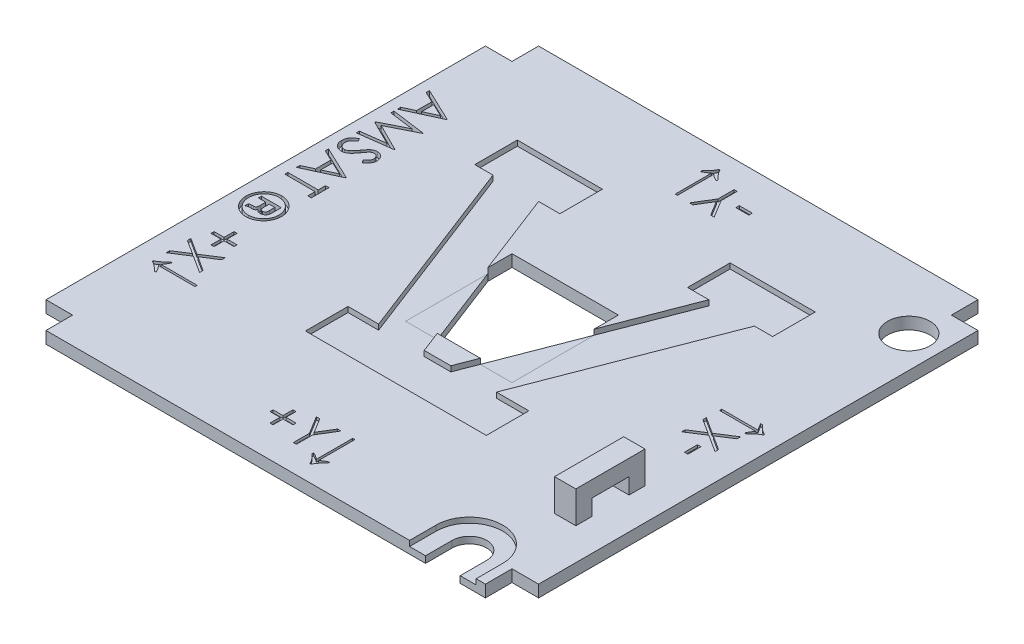
from build123d import *

# Parameters (mm, degrees)
BOSS_EXTRUDE1_DEPTH   = 2.25
CUT_EXTRUDE3_DEPTH    = 10
CUT_EXTRUDE4_DEPTH    = 1
SKETCH7_W             = 20
SKETCH7_H             = 20
CUT_EXTRUDE5_DEPTH    = 10
CUT_EXTRUDE9_DEPTH    = 1
CUT_EXTRUDE10_DEPTH   = 1
CUT_EXTRUDE7_DEPTH    = 1
BOSS_EXTRUDE3_DEPTH   = 2.25
BOSS_EXTRUDE3_2_DEPTH = 2.25
CUT_EXTRUDE8_DEPTH    = 1
SKETCH22_W            = 2.442307692
SKETCH22_H            = 0.651282051
SKETCH22_W_2          = 0.651282051
SKETCH22_H_2          = 2.442307693
CUT_EXTRUDE11_DEPTH   = 0.5
SKETCH23_W            = 4
SKETCH23_H            = 3
BOSS_EXTRUDE4_DEPTH   = 3
SKETCH24_W            = 4
SKETCH24_H            = 13
BOSS_EXTRUDE5_DEPTH   = 3
SKETCH3_R             = 4
CUT_EXTRUDE1_DEPTH    = 10


with BuildPart() as part:
    # Sketch2 → Boss-Extrude1 (new body)
    with BuildSketch(Plane(origin=(0, 0, 0), x_dir=(1, 0, 0), z_dir=(0, 1, 0))):
        Polygon((-41.3, 41.3), (-46.3, 41.3), (-46.3, -41.3), (-41.3, -41.3), (-41.3, -46.3), (41.3, -46.3), (41.3, -41.3), (46.3, -41.3), (46.3, 41.3), (41.3, 41.3), (41.3, 46.3), (-41.3, 46.3), align=None)
    extrude(amount=BOSS_EXTRUDE1_DEPTH)

    # Sketch5 → Cut-Extrude3 (cut)
    with BuildSketch(Plane(origin=(0, 2.25, 0), x_dir=(1, 0, 0), z_dir=(0, 1, 0))):
        with BuildLine():
            Line((30.05, -41.3), (30.05, -46.3))
            Line((30.05, -46.3), (36.55, -46.3))
            Line((36.55, -46.3), (36.55, -41.3))
            ThreePointArc((36.55, -41.3), (33.3, -38.05), (30.05, -41.3))
        make_face()
    extrude(amount=-CUT_EXTRUDE3_DEPTH, mode=Mode.SUBTRACT)

    # Sketch6 → Cut-Extrude4 (cut)
    with BuildSketch(Plane(origin=(0, 2.25, 0), x_dir=(1, 0, 0), z_dir=(0, 1, 0))):
        with BuildLine():
            Line((27.05, -46.3), (27.05, -41.3))
            ThreePointArc((27.05, -41.3), (33.3, -35.05), (39.55, -41.3))
            Line((39.55, -41.3), (39.55, -46.3))
            Line((39.55, -46.3), (36.55, -46.3))
            Line((36.55, -46.3), (36.55, -41.3))
            Line((36.55, -41.3), (30.05, -41.3))
            Line((30.05, -41.3), (30.05, -46.3))
            Line((30.05, -46.3), (27.05, -46.3))
        make_face()
    extrude(amount=-CUT_EXTRUDE4_DEPTH, mode=Mode.SUBTRACT)

    # Sketch7 → Cut-Extrude5 (cut)
    with BuildSketch(Plane(origin=(0, 2.25, 0), x_dir=(1, 0, 0), z_dir=(0, 1, 0))):
        Rectangle(SKETCH7_W, SKETCH7_H)
    extrude(amount=-CUT_EXTRUDE5_DEPTH, mode=Mode.SUBTRACT)

    # Sketch12 → Cut-Extrude9 (cut)
    # profile 1 of 5: a face of its own
    with BuildSketch(Plane(origin=(0, 2.25, 0), x_dir=(1, 0, 0), z_dir=(0, 1, 0))):
        Polygon((-37.95, 25.69277339), (-44.3, 22.762004159), (-44.3, 23.381485329), (-42.26474359, 24.320247348), (-42.26474359, 27.198863133), (-44.3, 28.164337893), (-44.3, 28.786363133), (-37.95, 25.774183646), align=None)
        Polygon((-39.187690304, 25.739838694), (-41.613461538, 26.889758566), (-41.613461538, 24.620447669), align=None, mode=Mode.SUBTRACT)
    # profile 2 of 5: a face of its own
    with BuildSketch(Plane(origin=(0, 2.25, 0), x_dir=(1, 0, 0), z_dir=(0, 1, 0))):
        Polygon((-44.3, 22.110722108), (-37.95, 21.272450874), (-37.95, 21.191040617), (-43.16025641, 18.569375954), (-37.95, 15.954071467), (-37.95, 15.871389175), (-44.3, 15.0280298), (-44.3, 15.600445666), (-39.730849359, 16.208478518), (-44.3, 18.50068605), (-44.3, 18.629161611), (-39.720673077, 20.93027339), (-44.3, 21.537034207), align=None)
    # profile 3 of 5: a face of its own
    with BuildSketch(Plane(origin=(0, 2.25, 0), x_dir=(1, 0, 0), z_dir=(0, 1, 0))):
        with BuildLine():
            Line((-43.075030048, 14.376747749), (-42.753205128, 13.839948871))
            add(Edge.make_bspline(
                [(-42.753205128, 13.839948871), (-42.836779084, 13.790022926), (-42.996903557, 13.694366742), (-43.213271716, 13.534797848), (-43.397171629, 13.369456709), (-43.547533475, 13.197118918), (-43.665913598, 13.018836412), (-43.749737647, 12.833445344), (-43.802018059, 12.641570458), (-43.808368216, 12.510989382), (-43.811538462, 12.44579823)],
                knots=[0, 0, 0, 0, 1.272034388, 2.437168799, 3.508375237, 4.49857839, 5.41946034, 6.295179144, 7.148887113, 8, 8, 8, 8], degree=3))
            add(Edge.make_bspline(
                [(-43.811538462, 12.44579823), (-43.809987843, 12.390123491), (-43.806913739, 12.279748192), (-43.777375684, 12.117256778), (-43.731996643, 11.959446619), (-43.667006837, 11.809572137), (-43.588379893, 11.66969437), (-43.493403869, 11.547051602), (-43.387093572, 11.440960092), (-43.268404913, 11.354415497), (-43.141200057, 11.287230367), (-43.009462302, 11.238613348), (-42.873771122, 11.20767154), (-42.781776598, 11.203733268), (-42.735396635, 11.201747749)],
                knots=[0, 0, 0, 0, 1.095270387, 2.171376115, 3.241375676, 4.322296363, 5.380636668, 6.392615365, 7.366724986, 8.328592944, 9.273498763, 10.190095884, 11.087518669, 12, 12, 12, 12], degree=3))
            add(Edge.make_bspline(
                [(-42.735396635, 11.201747749), (-42.682526807, 11.20442257), (-42.575050174, 11.20986009), (-42.416482232, 11.255818632), (-42.259559998, 11.328116551), (-42.162493416, 11.394814491), (-42.112099359, 11.42944206)],
                knots=[0, 0, 0, 0, 0.938893495, 1.908633276, 2.914225137, 4, 4, 4, 4], degree=3))
            add(Edge.make_bspline(
                [(-42.112099359, 11.42944206), (-42.075654343, 11.457792544), (-41.998918, 11.517485547), (-41.88660379, 11.621528823), (-41.767920761, 11.740440233), (-41.643350859, 11.874814245), (-41.51516904, 12.027321936), (-41.380703341, 12.194831747), (-41.240357882, 12.378210806), (-41.1475488, 12.50744808), (-41.099559295, 12.574273791)],
                knots=[0, 0, 0, 0, 0.72226686, 1.520759855, 2.393439377, 3.351307446, 4.386958158, 5.510256019, 6.712608938, 8, 8, 8, 8], degree=3))
            add(Edge.make_bspline(
                [(-41.099559295, 12.574273791), (-41.051962251, 12.641074129), (-40.960960328, 12.76879129), (-40.826074223, 12.947538499), (-40.701964103, 13.107163547), (-40.590358776, 13.248479803), (-40.486390583, 13.367831235), (-40.395631639, 13.469580999), (-40.313235518, 13.549975161), (-40.25982663, 13.594712616), (-40.235847356, 13.61479863)],
                knots=[0, 0, 0, 0, 1.452255772, 2.776602448, 3.96446981, 5.032613149, 5.964194703, 6.766668629, 7.446264616, 8, 8, 8, 8], degree=3))
            add(Edge.make_bspline(
                [(-40.235847356, 13.61479863), (-40.198471189, 13.642870248), (-40.124965941, 13.698076852), (-40.010076556, 13.770949462), (-39.892468631, 13.832887657), (-39.771826134, 13.881442174), (-39.649842763, 13.922329314), (-39.524926932, 13.949830131), (-39.397639153, 13.967050237), (-39.311980373, 13.968813698), (-39.269100561, 13.969696467)],
                knots=[0, 0, 0, 0, 1.068054152, 2.10047183, 3.106115577, 4.101338837, 5.06977816, 6.043150881, 7.020423561, 8, 8, 8, 8], degree=3))
            add(Edge.make_bspline(
                [(-39.269100561, 13.969696467), (-39.201912345, 13.967338774), (-39.068972014, 13.962673783), (-38.874869119, 13.922898978), (-38.688987153, 13.860852909), (-38.515420527, 13.771116127), (-38.35457513, 13.660168238), (-38.208908417, 13.529045262), (-38.085408301, 13.373365589), (-37.978755215, 13.201602473), (-37.894548144, 13.014807794), (-37.830689649, 12.819420139), (-37.794988839, 12.614582726), (-37.789808182, 12.4756091), (-37.787179487, 12.405093101)],
                knots=[0, 0, 0, 0, 1.005541892, 1.989591032, 2.955705311, 3.932863626, 4.905387107, 5.876519979, 6.856563935, 7.871847665, 8.897921447, 9.918317993, 10.943742853, 12, 12, 12, 12], degree=3))
            add(Edge.make_bspline(
                [(-37.787179487, 12.405093101), (-37.789712055, 12.330253365), (-37.79473444, 12.181837219), (-37.839966426, 11.963114106), (-37.913030405, 11.752123978), (-37.997182386, 11.582287263), (-38.080853419, 11.44959562), (-38.157094819, 11.348409701), (-38.244859474, 11.245870377), (-38.344390297, 11.141153488), (-38.456597833, 11.036032532), (-38.58071441, 10.928947139), (-38.715981292, 10.819646819), (-38.812545746, 10.749332616), (-38.862049279, 10.71328621)],
                knots=[0, 0, 0, 0, 1.286821612, 2.551921131, 3.825787379, 5.12137259, 5.803616487, 6.523126609, 7.299589446, 8.125436757, 9.008162487, 9.944516264, 10.946261234, 12, 12, 12, 12], degree=3))
            Line((-38.862049279, 10.71328621), (-39.252564103, 11.228460489))
            add(Edge.make_bspline(
                [(-39.252564103, 11.228460489), (-39.212488906, 11.259568109), (-39.135313447, 11.319474112), (-39.027234075, 11.410423329), (-38.928506984, 11.49614586), (-38.842754703, 11.580601638), (-38.76528029, 11.659329911), (-38.698952227, 11.735742826), (-38.643110719, 11.808737593), (-38.583547263, 11.900760248), (-38.524128308, 12.01666691), (-38.474919269, 12.162019776), (-38.444283214, 12.313503716), (-38.440423429, 12.416395831), (-38.438461538, 12.468694864)],
                knots=[0, 0, 0, 0, 1.181667846, 2.275615987, 3.290305621, 4.226321945, 5.078535498, 5.862783384, 6.581873284, 7.217493746, 8.414623899, 9.604724551, 10.782505457, 12, 12, 12, 12], degree=3))
            add(Edge.make_bspline(
                [(-38.438461538, 12.468694864), (-38.440659908, 12.534293126), (-38.444899258, 12.660793195), (-38.491199802, 12.840389766), (-38.564101178, 13.002031602), (-38.666272638, 13.140919827), (-38.787323582, 13.256556914), (-38.926622362, 13.340205389), (-39.080441863, 13.390552116), (-39.187741726, 13.396695795), (-39.242387821, 13.399824672)],
                knots=[0, 0, 0, 0, 1.14458467, 2.207223713, 3.21896685, 4.227309161, 5.202851033, 6.127160689, 7.046193047, 8, 8, 8, 8], degree=3))
            add(Edge.make_bspline(
                [(-39.242387821, 13.399824672), (-39.276399686, 13.399078224), (-39.344479035, 13.397584107), (-39.445325449, 13.378151522), (-39.545276684, 13.350596701), (-39.644777183, 13.310268524), (-39.746167771, 13.25594828), (-39.849174706, 13.182089077), (-39.956398665, 13.089688175), (-40.026067509, 13.018768516), (-40.062850561, 12.981325073)],
                knots=[0, 0, 0, 0, 0.858526328, 1.718456515, 2.587092892, 3.476767204, 4.426280253, 5.487868114, 6.673670035, 8, 8, 8, 8], degree=3))
            add(Edge.make_bspline(
                [(-40.062850561, 12.981325073), (-40.075254879, 12.967425154), (-40.1047247, 12.934402129), (-40.152970695, 12.874030093), (-40.212484296, 12.794305302), (-40.286121284, 12.697309594), (-40.371540509, 12.581254523), (-40.467649776, 12.446127328), (-40.577569109, 12.293434262), (-40.65441779, 12.185081643), (-40.695052083, 12.127789416)],
                knots=[0, 0, 0, 0, 0.420754252, 0.999615792, 1.744751191, 2.668019286, 3.750313428, 4.999500688, 6.413464383, 8, 8, 8, 8], degree=3))
            add(Edge.make_bspline(
                [(-40.695052083, 12.127789416), (-40.745201407, 12.058872116), (-40.842308622, 11.925423316), (-40.988205641, 11.735544564), (-41.130895164, 11.563380084), (-41.269465966, 11.408325414), (-41.402866935, 11.268848738), (-41.53270299, 11.146497444), (-41.658043958, 11.040024853), (-41.818739917, 10.925399699), (-42.016099884, 10.80827337), (-42.257904688, 10.707686635), (-42.500649441, 10.644262204), (-42.663802416, 10.635968169), (-42.744300881, 10.631875954)],
                knots=[0, 0, 0, 0, 1.163667725, 2.253281268, 3.268753668, 4.215851969, 5.092017293, 5.902905408, 6.650798638, 7.335211899, 8.59617414, 9.77448103, 10.901945474, 12, 12, 12, 12], degree=3))
            add(Edge.make_bspline(
                [(-42.744300881, 10.631875954), (-42.801229752, 10.633068853), (-42.913981973, 10.635431485), (-43.079551282, 10.662565226), (-43.240328731, 10.70236958), (-43.394472649, 10.762174417), (-43.544045611, 10.835740017), (-43.687669837, 10.926604091), (-43.823370944, 11.036140674), (-43.953972858, 11.157886149), (-44.071943933, 11.293185837), (-44.177455847, 11.43584641), (-44.265768656, 11.586794036), (-44.336860696, 11.745298111), (-44.393343689, 11.910481824), (-44.433942484, 12.082519011), (-44.458916787, 12.261888745), (-44.461504744, 12.383810693), (-44.462820513, 12.44579823)],
                knots=[0, 0, 0, 0, 0.983610584, 1.948120116, 2.894308362, 3.843560551, 4.801159957, 5.773581695, 6.77566113, 7.813174769, 8.857584665, 9.875476876, 10.877851407, 11.875574773, 12.875048225, 13.892438445, 14.928473903, 16, 16, 16, 16], degree=3))
            add(Edge.make_bspline(
                [(-44.462820513, 12.44579823), (-44.461882457, 12.493757378), (-44.460018158, 12.589071679), (-44.443927019, 12.729674644), (-44.420329169, 12.867695712), (-44.384350994, 13.001401863), (-44.339671815, 13.13245798), (-44.284968625, 13.259695869), (-44.219847258, 13.383424662), (-44.144199851, 13.503788839), (-44.05701888, 13.621922576), (-43.956268568, 13.737220237), (-43.842644818, 13.851000836), (-43.71498239, 13.9611786), (-43.574645227, 14.069784393), (-43.420457442, 14.174798493), (-43.253219433, 14.278359297), (-43.135535911, 14.343339035), (-43.075030048, 14.376747749)],
                knots=[0, 0, 0, 0, 0.915384692, 1.819241058, 2.699029451, 3.586605375, 4.459625921, 5.340865773, 6.228072412, 7.126546901, 8.052715223, 9.028303326, 10.047266019, 11.120332924, 12.245748783, 13.433636234, 14.680528497, 16, 16, 16, 16], degree=3))
        make_face()
    # profile 4 of 5: a face of its own
    with BuildSketch(Plane(origin=(0, 2.25, 0), x_dir=(1, 0, 0), z_dir=(0, 1, 0))):
        Polygon((-37.95, 6.724183646), (-44.3, 3.793414416), (-44.3, 4.412895585), (-42.26474359, 5.351657605), (-42.26474359, 8.23027339), (-44.3, 9.195748149), (-44.3, 9.81777339), (-37.95, 6.805593903), align=None)
        Polygon((-39.187690304, 6.771248951), (-41.613461538, 7.921168823), (-41.613461538, 5.651857925), align=None, mode=Mode.SUBTRACT)
    # profile 5 of 5: a face of its own
    with BuildSketch(Plane(origin=(0, 2.25, 0), x_dir=(1, 0, 0), z_dir=(0, 1, 0))):
        Polygon((-38.601282051, 3.549183646), (-37.95, 3.549183646), (-37.95, 0.211363133), (-38.601282051, 0.211363133), (-38.601282051, 1.595337492), (-44.3, 1.595337492), (-44.3, 2.165209287), (-38.601282051, 2.165209287), align=None)
    extrude(amount=-CUT_EXTRUDE9_DEPTH, mode=Mode.SUBTRACT)

    # Sketch21 → Cut-Extrude10 (cut)
    # profile 1 of 2: a face of its own
    with BuildSketch(Plane(origin=(0, 2.25, 0), x_dir=(1, 0, 0), z_dir=(0, 1, 0))):
        with BuildLine():
            add(Edge.make_bspline(
                [(-41.037229567, -8.996703827), (-41.185025561, -8.994941244), (-41.405937841, -8.983966074), (-41.695013938, -8.935440543), (-41.906637632, -8.885818691), (-42.114142537, -8.822359309), (-42.317418418, -8.74391298), (-42.517002942, -8.652773965), (-42.711344658, -8.546897571), (-42.898657192, -8.429725798), (-43.076064204, -8.300134551), (-43.244757317, -8.161773217), (-43.402327399, -8.011171929), (-43.550390858, -7.850710696), (-43.687693075, -7.679324729), (-43.817196462, -7.498993653), (-43.932709462, -7.307124199), (-44.038585529, -7.109692408), (-44.129806593, -6.907216656), (-44.208743963, -6.701669085), (-44.269954104, -6.491515382), (-44.320134867, -6.278937571), (-44.368634279, -5.989414625), (-44.379667073, -5.768526321), (-44.381410256, -5.620722256)],
                knots=[0, 0, 0, 0, 0.084081566, 0.125371117, 0.166471693, 0.207566613, 0.248614148, 0.290245601, 0.332200249, 0.37433108, 0.415744967, 0.457006367, 0.498264248, 0.539544652, 0.58102722, 0.623028231, 0.665647139, 0.708238775, 0.750308889, 0.79180686, 0.833293628, 0.874628883, 0.915918434, 1, 1, 1, 1], degree=3))
            add(Edge.make_bspline(
                [(-37.705769231, -5.620722256), (-37.704080099, -5.769216124), (-37.720136076, -5.990400947), (-37.765552914, -6.281016807), (-37.814108136, -6.493908612), (-37.876550896, -6.702986469), (-37.953096143, -6.908211958), (-38.04364369, -7.109602805), (-38.147621504, -7.305714146), (-38.263229735, -7.495423023), (-38.390020448, -7.67581506), (-38.52805122, -7.845528591), (-38.676278958, -8.005378133), (-38.83530041, -8.155260381), (-39.004418338, -8.295644859), (-39.185218114, -8.424372289), (-39.374446991, -8.543285117), (-39.570959833, -8.649469881), (-39.770684486, -8.74296099), (-39.973983084, -8.820853083), (-40.180703646, -8.884204487), (-40.390291897, -8.935701592), (-40.675362882, -8.983455777), (-40.892346195, -8.995263606), (-41.037229567, -8.996703827)],
                knots=[0, 0, 0, 0, 0.084514054, 0.126089622, 0.167456995, 0.208798976, 0.250298702, 0.292137242, 0.334491317, 0.376661106, 0.418610353, 0.459991826, 0.501181122, 0.542700524, 0.584388198, 0.626280387, 0.669036822, 0.711618933, 0.753438644, 0.794571956, 0.835521899, 0.8765295, 0.917428837, 1, 1, 1, 1], degree=3))
            add(Edge.make_bspline(
                [(-41.053766026, -2.239652545), (-40.907207032, -2.241168371), (-40.687647811, -2.252754617), (-40.400175455, -2.300715851), (-40.189081764, -2.350777818), (-39.981001675, -2.414170416), (-39.777030342, -2.493450355), (-39.575642941, -2.585186008), (-39.379988073, -2.692135268), (-39.189917948, -2.809224367), (-39.00950782, -2.938201824), (-38.840808271, -3.078568793), (-38.680567629, -3.227602011), (-38.531924227, -3.387986101), (-38.393761786, -3.559264749), (-38.267279345, -3.741352191), (-38.149773733, -3.931463838), (-38.046929911, -4.129433814), (-37.953701498, -4.330632119), (-37.878118854, -4.536896779), (-37.815509182, -4.74680099), (-37.765322579, -4.959857613), (-37.720345405, -5.251089431), (-37.703973566, -5.472205046), (-37.705769231, -5.620722256)],
                knots=[0, 0, 0, 0, 0.083231423, 0.124456947, 0.165259547, 0.206290743, 0.247810239, 0.289377135, 0.331804555, 0.374278361, 0.416018365, 0.457554597, 0.49875834, 0.54013811, 0.581556351, 0.623550197, 0.665897685, 0.70831077, 0.750096537, 0.791671096, 0.832862889, 0.874368434, 0.915792968, 1, 1, 1, 1], degree=3))
            add(Edge.make_bspline(
                [(-44.381410256, -5.620722256), (-44.379558287, -5.472956417), (-44.368828326, -5.25153536), (-44.319678737, -4.961888521), (-44.272405297, -4.748514834), (-44.207316139, -4.539689589), (-44.132027545, -4.332863627), (-44.03935247, -4.13094126), (-43.93567913, -3.932587601), (-43.819366368, -3.74172946), (-43.691825576, -3.559971457), (-43.552723157, -3.3899736), (-43.405043319, -3.228834319), (-43.246808709, -3.078563402), (-43.078938004, -2.938237631), (-42.90003963, -2.809572349), (-42.712317739, -2.692159042), (-42.518935428, -2.584860969), (-42.319349063, -2.493807998), (-42.117329026, -2.413893003), (-41.910812948, -2.350810215), (-41.70140652, -2.300865281), (-41.416534612, -2.252597153), (-41.199038731, -2.24131999), (-41.053766026, -2.239652545)],
                knots=[0, 0, 0, 0, 0.084268799, 0.125888631, 0.167261664, 0.208679102, 0.250410951, 0.292574748, 0.335148295, 0.377862107, 0.419817093, 0.461544047, 0.502916375, 0.544266128, 0.585773641, 0.627475415, 0.669700064, 0.71186386, 0.753368561, 0.794594645, 0.83555019, 0.876272109, 0.917177041, 1, 1, 1, 1], degree=3))
        make_face()
        with BuildLine():
            add(Edge.make_bspline(
                [(-41.043589744, -8.508242288), (-40.919097987, -8.507277755), (-40.73282162, -8.496925282), (-40.489082322, -8.455506635), (-40.309676413, -8.413415455), (-40.133125907, -8.35900123), (-39.959689197, -8.290876691), (-39.788998792, -8.211767148), (-39.621458047, -8.122268639), (-39.460525748, -8.020263971), (-39.306978255, -7.910113274), (-39.161795272, -7.791421575), (-39.027695093, -7.662034984), (-38.899423308, -7.526722239), (-38.783119321, -7.380354006), (-38.672201724, -7.228057059), (-38.574551414, -7.065430397), (-38.485105671, -6.898011257), (-38.407856586, -6.726151873), (-38.340805407, -6.551513325), (-38.287803062, -6.372715819), (-38.245371071, -6.191018024), (-38.20668801, -5.943087253), (-38.194454079, -5.754643231), (-38.194230769, -5.628354468)],
                knots=[0, 0, 0, 0, 0.083086621, 0.124098934, 0.164782219, 0.205935711, 0.247220212, 0.28898156, 0.331375079, 0.373828943, 0.415981172, 0.457375012, 0.498787209, 0.540210995, 0.581645401, 0.623402918, 0.665799268, 0.708059538, 0.749960496, 0.791407451, 0.832749076, 0.874258715, 0.915783768, 1, 1, 1, 1], degree=3))
            add(Edge.make_bspline(
                [(-43.892948718, -5.628354468), (-43.892854073, -5.754261112), (-43.880061897, -5.942149919), (-43.842396224, -6.189558621), (-43.797520788, -6.370365078), (-43.744973365, -6.549322012), (-43.6783207, -6.724568446), (-43.600543765, -6.897235248), (-43.510673921, -7.06541623), (-43.409904176, -7.22745761), (-43.302785864, -7.383608001), (-43.183612027, -7.528291771), (-43.057134321, -7.664689727), (-42.924141991, -7.793986775), (-42.780287345, -7.912126939), (-42.629513835, -8.023463495), (-42.469308933, -8.122841507), (-42.30409144, -8.213738214), (-42.134384757, -8.292065045), (-41.96108282, -8.358942757), (-41.784776744, -8.413652447), (-41.604039255, -8.455630499), (-41.357708094, -8.49674846), (-41.169377704, -8.507600864), (-41.043589744, -8.508242288)],
                knots=[0, 0, 0, 0, 0.083922308, 0.125441802, 0.166735303, 0.208071393, 0.24977732, 0.291672667, 0.334309784, 0.376848307, 0.418898952, 0.460506, 0.501731656, 0.542934025, 0.584104354, 0.625793017, 0.667851269, 0.709741844, 0.751497601, 0.792410697, 0.833558679, 0.87451183, 0.916076567, 1, 1, 1, 1], degree=3))
            add(Edge.make_bspline(
                [(-41.05249399, -2.728114083), (-41.17740134, -2.729052496), (-41.364132062, -2.739314103), (-41.608249757, -2.780918013), (-41.787373189, -2.822593603), (-41.962980018, -2.878017617), (-42.136408973, -2.943543034), (-42.305760537, -3.023491302), (-42.472137213, -3.112759587), (-42.631183376, -3.214618105), (-42.783847152, -3.324269685), (-42.927323843, -3.443471448), (-43.0617338, -3.573034824), (-43.187163043, -3.711437773), (-43.305031351, -3.858704674), (-43.414442347, -4.014677775), (-43.513158247, -4.180002635), (-43.60136719, -4.350604278), (-43.679739236, -4.524464955), (-43.746075968, -4.701087006), (-43.799444533, -4.881436754), (-43.841641057, -5.064033736), (-43.880662333, -5.312747856), (-43.892562982, -5.501662582), (-43.892948718, -5.628354468)],
                knots=[0, 0, 0, 0, 0.083160864, 0.124070639, 0.164652209, 0.205433361, 0.246513038, 0.287914089, 0.329953356, 0.372062625, 0.413486741, 0.45495695, 0.49606181, 0.537605853, 0.579156602, 0.621500564, 0.664273779, 0.707177994, 0.74923146, 0.791102819, 0.8326114, 0.874292216, 0.91571345, 1, 1, 1, 1], degree=3))
            add(Edge.make_bspline(
                [(-38.194230769, -5.628354468), (-38.194419414, -5.50121242), (-38.206758121, -5.311526117), (-38.245204318, -5.062269886), (-38.287978548, -4.879799857), (-38.341011407, -4.699779187), (-38.40782083, -4.522942971), (-38.485090619, -4.34855313), (-38.574532608, -4.178588456), (-38.67217358, -4.01343352), (-38.783131744, -3.858606905), (-38.899072787, -3.709836471), (-39.027258608, -3.573031631), (-39.162317052, -3.443874346), (-39.306108346, -3.323416915), (-39.461023438, -3.21508512), (-39.621365212, -3.112669485), (-39.789078957, -3.023501869), (-39.959685487, -2.943522244), (-40.134393987, -2.878038803), (-40.311638573, -2.822371966), (-40.492548533, -2.781097789), (-40.738729918, -2.73923946), (-40.926749158, -2.729090894), (-41.05249399, -2.728114083)],
                knots=[0, 0, 0, 0, 0.084265662, 0.125816231, 0.167073799, 0.208433723, 0.250155126, 0.292314647, 0.334815834, 0.377435864, 0.419398092, 0.461019926, 0.502397999, 0.543558718, 0.584880408, 0.626613175, 0.668809235, 0.710945317, 0.752453067, 0.793648332, 0.834551917, 0.875535607, 0.916576146, 1, 1, 1, 1], degree=3))
        make_face(mode=Mode.SUBTRACT)
    # profile 2 of 2: a face of its own
    with BuildSketch(Plane(origin=(0, 2.25, 0), x_dir=(1, 0, 0), z_dir=(0, 1, 0))):
        with BuildLine():
            Line((-39.171153846, -5.775910558), (-39.171153846, -4.193498699))
            Line((-39.171153846, -4.193498699), (-42.916025641, -4.193498699))
            Line((-42.916025641, -4.193498699), (-42.916025641, -4.763370493))
            Line((-42.916025641, -4.763370493), (-41.532051282, -4.763370493))
            Line((-41.532051282, -4.763370493), (-41.532051282, -5.769550381))
            add(Edge.make_bspline(
                [(-42.020512821, -6.554396134), (-41.956735264, -6.547416281), (-41.866530544, -6.53837851), (-41.762015173, -6.502174133), (-41.704701262, -6.470544689), (-41.660882537, -6.430542544), (-41.622858556, -6.385835164), (-41.593821974, -6.332321022), (-41.569297824, -6.268458782), (-41.551651269, -6.184563049), (-41.534544688, -6.016425353), (-41.5322698, -5.874308872), (-41.532051282, -5.769550381)],
                knots=[0, 0, 0, 0, 0.179641353, 0.249903677, 0.30706132, 0.360638264, 0.414345343, 0.469892587, 0.529360675, 0.604463637, 0.707938712, 1, 1, 1, 1], degree=3))
            Line((-42.020512821, -6.554396134), (-42.427564103, -6.574748699))
            add(Edge.make_bspline(
                [(-42.916025641, -6.635806391), (-42.841651587, -6.619567658), (-42.679132453, -6.5953224), (-42.515616278, -6.579518291), (-42.427564103, -6.574748699)],
                knots=[0, 0, 0, 0, 0.463213932, 1, 1, 1, 1], degree=3))
            Line((-42.916025641, -6.635806391), (-42.916025641, -7.368498699))
            Line((-42.916025641, -7.368498699), (-42.816806891, -7.290904548))
            add(Edge.make_bspline(
                [(-42.319441106, -7.124267929), (-42.411999803, -7.12304751), (-42.591490743, -7.148949358), (-42.751007609, -7.235410471), (-42.816806891, -7.290904548)],
                knots=[0, 0, 0, 0, 0.51899268, 1, 1, 1, 1], degree=3))
            Line((-42.319441106, -7.124267929), (-41.897125401, -7.124267929))
            add(Edge.make_bspline(
                [(-41.047405849, -6.68159966), (-41.083160139, -6.759708663), (-41.146524087, -6.864558162), (-41.251200503, -6.978618556), (-41.336174878, -7.038693297), (-41.439490244, -7.078732939), (-41.626895792, -7.117609293), (-41.783645007, -7.125378877), (-41.897125401, -7.124267929)],
                knots=[0, 0, 0, 0, 0.248758357, 0.352184632, 0.446606134, 0.547460389, 0.670874122, 1, 1, 1, 1], degree=3))
            add(Edge.make_bspline(
                [(-40.711588542, -7.055578025), (-40.773822444, -7.020632686), (-40.895574793, -6.901742722), (-40.99585164, -6.765502952), (-41.047405849, -6.68159966)],
                knots=[0, 0, 0, 0, 0.418043723, 1, 1, 1, 1], degree=3))
            add(Edge.make_bspline(
                [(-40.219310897, -7.124267929), (-40.308426256, -7.126678042), (-40.474277794, -7.111710243), (-40.638356585, -7.081954397), (-40.711588542, -7.055578025)],
                knots=[0, 0, 0, 0, 0.534351952, 1, 1, 1, 1], degree=3))
            add(Edge.make_bspline(
                [(-39.171153846, -5.775910558), (-39.170760669, -5.862020148), (-39.173324387, -5.986445447), (-39.185177255, -6.145477365), (-39.198297791, -6.250191982), (-39.212865728, -6.34545132), (-39.23162335, -6.430990644), (-39.254848411, -6.506442235), (-39.287832052, -6.594377099), (-39.342753381, -6.69210624), (-39.423921502, -6.798194891), (-39.523077409, -6.892806805), (-39.63829461, -6.975440172), (-39.768178268, -7.040693844), (-39.959503574, -7.108838942), (-40.114964471, -7.122077707), (-40.219310897, -7.124267929)],
                knots=[0, 0, 0, 0, 0.131785794, 0.19036453, 0.243969783, 0.293257433, 0.337811016, 0.377839134, 0.413992496, 0.48137038, 0.548472713, 0.617773073, 0.69034139, 0.764635786, 0.839542622, 1, 1, 1, 1], degree=3))
        make_face()
        with BuildLine():
            Line((-40.880769231, -4.763370493), (-39.822435897, -4.763370493))
            Line((-39.822435897, -4.763370493), (-39.822435897, -5.767006311))
            add(Edge.make_bspline(
                [(-40.347786458, -6.554396134), (-40.267890457, -6.555812265), (-40.15144409, -6.537957401), (-40.019637927, -6.465724347), (-39.956921203, -6.403551523), (-39.918541001, -6.341781915), (-39.891127631, -6.286863659), (-39.870786232, -6.221815288), (-39.852543947, -6.148386548), (-39.839187282, -6.065827577), (-39.824561861, -5.93790657), (-39.824296556, -5.836918467), (-39.822435897, -5.767006311)],
                knots=[0, 0, 0, 0, 0.220304065, 0.315334337, 0.409335901, 0.459152797, 0.514956494, 0.577645899, 0.646090602, 0.72296648, 0.807444192, 1, 1, 1, 1], degree=3))
            add(Edge.make_bspline(
                [(-40.790454728, -6.324157753), (-40.75083476, -6.398043078), (-40.618458429, -6.524669711), (-40.438385554, -6.555843294), (-40.347786458, -6.554396134)],
                knots=[0, 0, 0, 0, 0.477172649, 1, 1, 1, 1], degree=3))
            add(Edge.make_bspline(
                [(-40.880769231, -5.728845253), (-40.882536105, -5.851961801), (-40.871970561, -6.05403589), (-40.829315055, -6.253651256), (-40.790454728, -6.324157753)],
                knots=[0, 0, 0, 0, 0.607223379, 1, 1, 1, 1], degree=3))
            Line((-40.880769231, -5.728845253), (-40.880769231, -4.763370493))
        make_face(mode=Mode.SUBTRACT)
    extrude(amount=-CUT_EXTRUDE10_DEPTH, mode=Mode.SUBTRACT)

    # Sketch18 → Cut-Extrude7 (cut)
    with BuildSketch(Plane(origin=(0, 2.25, 0), x_dir=(1, 0, 0), z_dir=(0, 1, 0))):
        Polygon((-2.5, -14), (-16, 21), (-12, 21), (-12, 29), (-28, 29), (-28, 21), (-24.574475649, 21), (-11.074475649, -14), (-16.824113427, -14), (-16.824113427, -22), (17.175886573, -22), (17.175886573, -14), (11.074475649, -14), (24.574475649, 21), (28, 21), (28, 29), (12, 29), (12, 21), (16, 21), (2.5, -14), align=None)
    extrude(amount=-CUT_EXTRUDE7_DEPTH, mode=Mode.SUBTRACT)

    # Sketch22 → Cut-Extrude11 (cut)
    with BuildSketch(Plane(origin=(0, 2.25, 0), x_dir=(1, 0, 0), z_dir=(0, 1, 0))):
        with BuildLine():
            add(Edge.make_bspline(
                [(-40.782652244, -26.458333333), (-40.865603402, -26.370426452), (-41.026344825, -26.200081909), (-41.269084536, -25.962036452), (-41.504740707, -25.749162433), (-41.731366375, -25.560413849), (-41.951114728, -25.397961489), (-42.162058928, -25.259808749), (-42.365726879, -25.14589947), (-42.502769753, -25.087258893), (-42.568589744, -25.059094551)],
                knots=[0, 0, 0, 0, 1.268919897, 2.458892609, 3.568401112, 4.602379556, 5.554201575, 6.435838317, 7.248752563, 8, 8, 8, 8], degree=3))
            Line((-42.568589744, -25.059094551), (-42.568589744, -24.873377404))
            add(Edge.make_bspline(
                [(-42.568589744, -24.873377404), (-42.498486652, -24.840545112), (-42.353661673, -24.772717348), (-42.141364869, -24.646553355), (-41.923706079, -24.500808242), (-41.702881295, -24.332466122), (-41.477687257, -24.142022631), (-41.24759275, -23.931215182), (-41.014525691, -23.697474643), (-40.861381426, -23.531486087), (-40.782652244, -23.446153846)],
                knots=[0, 0, 0, 0, 0.806674609, 1.666497584, 2.571372681, 3.536893284, 4.559717442, 5.645448402, 6.789560146, 8, 8, 8, 8], degree=3))
            Line((-40.782652244, -23.446153846), (-40.451923077, -23.446153846))
            add(Edge.make_bspline(
                [(-40.451923077, -23.446153846), (-40.484471117, -23.516795518), (-40.547891839, -23.654442695), (-40.64935602, -23.851429389), (-40.748436612, -24.036189719), (-40.851377879, -24.205419382), (-40.951733434, -24.362468561), (-41.055968393, -24.503574004), (-41.157829341, -24.63327658), (-41.230706152, -24.711033387), (-41.266025641, -24.748717949)],
                knots=[0, 0, 0, 0, 1.209567812, 2.356875072, 3.445837619, 4.469393631, 5.437034397, 6.343238918, 7.197056603, 8, 8, 8, 8], degree=3))
            Line((-41.266025641, -24.748717949), (-34.427564103, -24.748717949))
            Line((-34.427564103, -24.748717949), (-34.427564103, -25.155769231))
            Line((-34.427564103, -25.155769231), (-41.266025641, -25.155769231))
            add(Edge.make_bspline(
                [(-41.266025641, -25.155769231), (-41.188467457, -25.25535281), (-41.032774842, -25.455259862), (-40.820341975, -25.773532571), (-40.625188841, -26.108048438), (-40.509949054, -26.341024392), (-40.451923077, -26.458333333)],
                knots=[0, 0, 0, 0, 0.983597024, 1.974502037, 2.98011354, 4, 4, 4, 4], degree=3))
            Line((-40.451923077, -26.458333333), (-40.782652244, -26.458333333))
        make_face()
        Polygon((-42.65, -22.347115385), (-42.65, -21.689473157), (-40.052504006, -20.026923077), (-42.65, -18.364372997), (-42.65, -17.706730769), (-39.538601763, -19.697465946), (-36.3, -17.625320513), (-36.3, -18.28296274), (-39.024699519, -20.026923077), (-36.3, -21.770883413), (-36.3, -22.428525641), (-39.538601763, -20.355108173), align=None)
        Polygon((-39.719230769, -14.979487179), (-41.591666667, -14.979487179), (-41.591666667, -14.409615385), (-39.719230769, -14.409615385), (-39.719230769, -12.537179487), (-39.149358974, -12.537179487), (-39.149358974, -14.409615385), (-37.276923077, -14.409615385), (-37.276923077, -14.979487179), (-39.149358974, -14.979487179), (-39.149358974, -16.851923077), (-39.719230769, -16.851923077), align=None)
        Polygon((-5.169551282, -37.880769231), (-5.169551282, -36.008333333), (-4.599679487, -36.008333333), (-4.599679487, -37.880769231), (-2.72724359, -37.880769231), (-2.72724359, -38.450641026), (-4.599679487, -38.450641026), (-4.599679487, -40.323076923), (-5.169551282, -40.323076923), (-5.169551282, -38.450641026), (-7.041987179, -38.450641026), (-7.041987179, -37.880769231), align=None)
        Polygon((-1.831730769, -34.95), (-1.179176683, -34.95), (0.489733574, -37.678515625), (2.15609976, -34.95), (2.808653846, -34.95), (0.773397436, -38.281460337), (0.773397436, -41.3), (0.203525641, -41.3), (0.203525641, -38.281460337), align=None)
        with BuildLine():
            Line((3.785576923, -41.382682292), (3.785576923, -41.055769231))
            add(Edge.make_bspline(
                [(3.785576923, -41.055769231), (3.902885864, -41.113795208), (4.135861818, -41.229034995), (4.470377685, -41.424188129), (4.788650394, -41.636620996), (4.988557446, -41.792313611), (5.088141026, -41.869871795)],
                knots=[0, 0, 0, 0, 1.01988646, 2.025497963, 3.016402976, 4, 4, 4, 4], degree=3))
            Line((5.088141026, -41.869871795), (5.088141026, -35.031410256))
            Line((5.088141026, -35.031410256), (5.495192308, -35.031410256))
            Line((5.495192308, -35.031410256), (5.495192308, -41.869871795))
            add(Edge.make_bspline(
                [(5.495192308, -41.869871795), (5.532946049, -41.834639391), (5.611040322, -41.761760547), (5.739824712, -41.658312909), (5.881947698, -41.554644879), (6.037658745, -41.452202884), (6.208246022, -41.351466696), (6.39205387, -41.251539961), (6.589850036, -41.152061485), (6.727185497, -41.088454291), (6.79775641, -41.055769231)],
                knots=[0, 0, 0, 0, 0.802803951, 1.660614015, 2.566661157, 3.537744655, 4.557739901, 5.646513329, 6.790642251, 8, 8, 8, 8], degree=3))
            Line((6.79775641, -41.055769231), (6.79775641, -41.386498397))
            add(Edge.make_bspline(
                [(6.79775641, -41.386498397), (6.712346304, -41.465150014), (6.545985409, -41.618346795), (6.313116739, -41.852707015), (6.101829136, -42.082749269), (5.91147491, -42.308022868), (5.743038424, -42.528785793), (5.597766748, -42.746299651), (5.470855007, -42.95773292), (5.403305494, -43.102298013), (5.370532853, -43.172435897)],
                knots=[0, 0, 0, 0, 1.210543577, 2.357883875, 3.443707871, 4.466619676, 5.432223013, 6.337175649, 7.193256267, 8, 8, 8, 8], degree=3))
            Line((5.370532853, -43.172435897), (5.184815705, -43.172435897))
            add(Edge.make_bspline(
                [(5.184815705, -43.172435897), (5.156598582, -43.10706487), (5.097682182, -42.970572371), (4.984188987, -42.767124105), (4.84554439, -42.556103181), (4.683950226, -42.335304612), (4.494707833, -42.108609332), (4.281556754, -41.872816781), (4.043542361, -41.62881944), (3.873447468, -41.466523777), (3.785576923, -41.382682292)],
                knots=[0, 0, 0, 0, 0.746358587, 1.558371544, 2.439030802, 3.39337854, 4.426210597, 5.534488972, 6.726323911, 8, 8, 8, 8], degree=3))
        make_face()
        with BuildLine():
            Line((-5.658012821, 41.382682292), (-5.658012821, 41.055769231))
            add(Edge.make_bspline(
                [(-5.658012821, 41.055769231), (-5.540652772, 41.113710154), (-5.307903897, 41.228618804), (-4.974130695, 41.424976771), (-4.65506258, 41.636166662), (-4.454980858, 41.792234626), (-4.355448718, 41.869871795)],
                knots=[0, 0, 0, 0, 1.019914214, 2.022697593, 3.01637621, 4, 4, 4, 4], degree=3))
            Line((-4.355448718, 41.869871795), (-4.355448718, 35.031410256))
            Line((-4.355448718, 35.031410256), (-3.948397436, 35.031410256))
            Line((-3.948397436, 35.031410256), (-3.948397436, 41.869871795))
            add(Edge.make_bspline(
                [(-3.948397436, 41.869871795), (-3.910648128, 41.834632496), (-3.832563024, 41.761739391), (-3.703704855, 41.658406496), (-3.562075903, 41.554398824), (-3.405129702, 41.453906084), (-3.235820568, 41.351102382), (-3.051453417, 41.251675108), (-2.853762149, 41.152024705), (-2.716411864, 41.088441806), (-2.645833333, 41.055769231)],
                knots=[0, 0, 0, 0, 0.802826809, 1.660661296, 2.566734236, 3.5342345, 4.557641891, 5.64644632, 6.790607818, 8, 8, 8, 8], degree=3))
            Line((-2.645833333, 41.055769231), (-2.645833333, 41.386498397))
            add(Edge.make_bspline(
                [(-2.645833333, 41.386498397), (-2.73124344, 41.465150014), (-2.897604334, 41.618346795), (-3.130473004, 41.852707015), (-3.341760607, 42.082749269), (-3.532114833, 42.308022868), (-3.70055132, 42.528785793), (-3.845822996, 42.746299651), (-3.972734737, 42.95773292), (-4.04028425, 43.102298013), (-4.073056891, 43.172435897)],
                knots=[0, 0, 0, 0, 1.210543577, 2.357883875, 3.443707871, 4.466619676, 5.432223013, 6.337175649, 7.193256267, 8, 8, 8, 8], degree=3))
            Line((-4.073056891, 43.172435897), (-4.258774038, 43.172435897))
            add(Edge.make_bspline(
                [(-4.258774038, 43.172435897), (-4.286985651, 43.107060721), (-4.345890545, 42.970559558), (-4.459478533, 42.767182669), (-4.597853404, 42.55564428), (-4.761175106, 42.336168075), (-4.948658013, 42.108084312), (-5.162153364, 41.872913424), (-5.400013895, 41.628792554), (-5.570130869, 41.466514619), (-5.658012821, 41.382682292)],
                knots=[0, 0, 0, 0, 0.746376284, 1.558408495, 2.439088635, 3.396097288, 4.426125859, 5.534430513, 6.726293711, 8, 8, 8, 8], degree=3))
        make_face()
        Polygon((-1.5875, 34.95), (-0.934945913, 34.95), (0.733964343, 37.678515625), (2.400330529, 34.95), (3.052884615, 34.95), (1.017628205, 38.281460337), (1.017628205, 41.3), (0.44775641, 41.3), (0.44775641, 38.281460337), align=None)
        with Locations((4.7625, 38.857692308)):
            Rectangle(SKETCH22_W, SKETCH22_H)
        with BuildLine():
            Line((41.382682292, 5.698717949), (41.055769231, 5.698717949))
            add(Edge.make_bspline(
                [(41.055769231, 5.698717949), (41.113795208, 5.581409008), (41.229034995, 5.348433054), (41.424188129, 5.013917186), (41.636620996, 4.695644477), (41.792313611, 4.495737426), (41.869871795, 4.396153846)],
                knots=[0, 0, 0, 0, 1.01988646, 2.025497963, 3.016402976, 4, 4, 4, 4], degree=3))
            Line((41.869871795, 4.396153846), (35.031410256, 4.396153846))
            Line((35.031410256, 4.396153846), (35.031410256, 3.989102564))
            Line((35.031410256, 3.989102564), (41.869871795, 3.989102564))
            add(Edge.make_bspline(
                [(41.869871795, 3.989102564), (41.834632496, 3.951353256), (41.761739391, 3.873268153), (41.658406496, 3.744409983), (41.554398824, 3.602781031), (41.453906084, 3.44583483), (41.351102382, 3.276525696), (41.251675108, 3.092158545), (41.152024705, 2.894467277), (41.088441806, 2.757116992), (41.055769231, 2.686538462)],
                knots=[0, 0, 0, 0, 0.802826809, 1.660661296, 2.566734236, 3.5342345, 4.557641891, 5.64644632, 6.790607818, 8, 8, 8, 8], degree=3))
            Line((41.055769231, 2.686538462), (41.386498397, 2.686538462))
            add(Edge.make_bspline(
                [(41.386498397, 2.686538462), (41.465150014, 2.771948568), (41.618346795, 2.938309463), (41.852707015, 3.171178133), (42.082749269, 3.382465736), (42.308022868, 3.572819962), (42.528785793, 3.741256448), (42.746299651, 3.886528124), (42.95773292, 4.013439865), (43.102298013, 4.080989378), (43.172435897, 4.113762019)],
                knots=[0, 0, 0, 0, 1.210543577, 2.357883875, 3.443707871, 4.466619676, 5.432223013, 6.337175649, 7.193256267, 8, 8, 8, 8], degree=3))
            Line((43.172435897, 4.113762019), (43.172435897, 4.299479167))
            add(Edge.make_bspline(
                [(43.172435897, 4.299479167), (43.10706487, 4.32769629), (42.970572371, 4.38661269), (42.767124105, 4.500105885), (42.556103181, 4.638750482), (42.335304612, 4.800344646), (42.108609332, 4.989587039), (41.872816781, 5.202738118), (41.62881944, 5.440752511), (41.466523777, 5.610847404), (41.382682292, 5.698717949)],
                knots=[0, 0, 0, 0, 0.746358587, 1.558371544, 2.439030802, 3.39337854, 4.426210597, 5.534488972, 6.726323911, 8, 8, 8, 8], degree=3))
        make_face()
        Polygon((34.95, 1.5875), (34.95, 0.929857772), (37.547495994, -0.732692308), (34.95, -2.395242388), (34.95, -3.052884615), (38.061398237, -1.062149439), (41.3, -3.134294872), (41.3, -2.476652644), (38.575300481, -0.732692308), (41.3, 1.011268029), (41.3, 1.668910256), (38.061398237, -0.404507212), align=None)
        with Locations((38.857692308, -4.884615384)):
            Rectangle(SKETCH22_W_2, SKETCH22_H_2)
    extrude(amount=-CUT_EXTRUDE11_DEPTH, mode=Mode.SUBTRACT)

    # Sketch23 → Boss-Extrude4 (add)
    with BuildSketch(Plane(origin=(0, 2.25, 0), x_dir=(1, 0, 0), z_dir=(0, 1, 0))):
        with Locations((38.3, -16.8)):
            Rectangle(SKETCH23_W, SKETCH23_H)
        with Locations((38.3, -26.8)):
            Rectangle(SKETCH23_W, SKETCH23_H)
    extrude(amount=BOSS_EXTRUDE4_DEPTH)

    # Sketch24 → Boss-Extrude5 (add)
    with BuildSketch(Plane(origin=(0, 5.25, 0), x_dir=(1, 0, 0), z_dir=(0, 1, 0))):
        with Locations((38.3, -21.8)):
            Rectangle(SKETCH24_W, SKETCH24_H)
    extrude(amount=BOSS_EXTRUDE5_DEPTH)

    # Sketch3 → Cut-Extrude1 (cut)
    with BuildSketch(Plane(origin=(0, 2.25, 0), x_dir=(1, 0, 0), z_dir=(0, 1, 0))):
        with Locations((40.3, 34.3)):
            Circle(SKETCH3_R)
    extrude(amount=-CUT_EXTRUDE1_DEPTH, mode=Mode.SUBTRACT)


with BuildPart() as body_2:
    # Sketch19 → Boss-Extrude3 (new body)
    with BuildSketch(Plane(origin=(0, 2.25, 0), x_dir=(1, 0, 0), z_dir=(0, 1, 0))):
        Polygon((10, 5.444444444), (4.042857143, -10), (10, -10), align=None)
    extrude(amount=-BOSS_EXTRUDE3_DEPTH)


with BuildPart() as body_3:
    # Sketch19 → Boss-Extrude3 2 (new body)
    with BuildSketch(Plane(origin=(0, 2.25, 0), x_dir=(1, 0, 0), z_dir=(0, 1, 0))):
        Polygon((-4.042857143, -10), (-10, 5.444444444), (-10, -10), align=None)
    extrude(amount=-BOSS_EXTRUDE3_2_DEPTH)


with BuildPart() as cut_extrude8_tool:
    # Sketch20 → Cut-Extrude8 (new body)
    with BuildSketch(Plane(origin=(0, 2.25, 0), x_dir=(1, 0, 0), z_dir=(0, 1, 0))):
        Polygon((-10, 5.444444444), (-10, -10), (-4.042857143, -10), align=None)
        Polygon((4.042857143, -10), (10, 5.444444444), (10, -10), align=None)
    extrude(amount=-CUT_EXTRUDE8_DEPTH)


with BuildPart() as body_2_1:
    add(body_2.part)

    # Cut-Extrude8: cut by cut_extrude8_tool
    add(cut_extrude8_tool.part, mode=Mode.SUBTRACT)


with BuildPart() as body_3_1:
    add(body_3.part)

    # Cut-Extrude8: cut by cut_extrude8_tool
    add(cut_extrude8_tool.part, mode=Mode.SUBTRACT)


solid = Compound([part.part, body_2_1.part, body_3_1.part])
